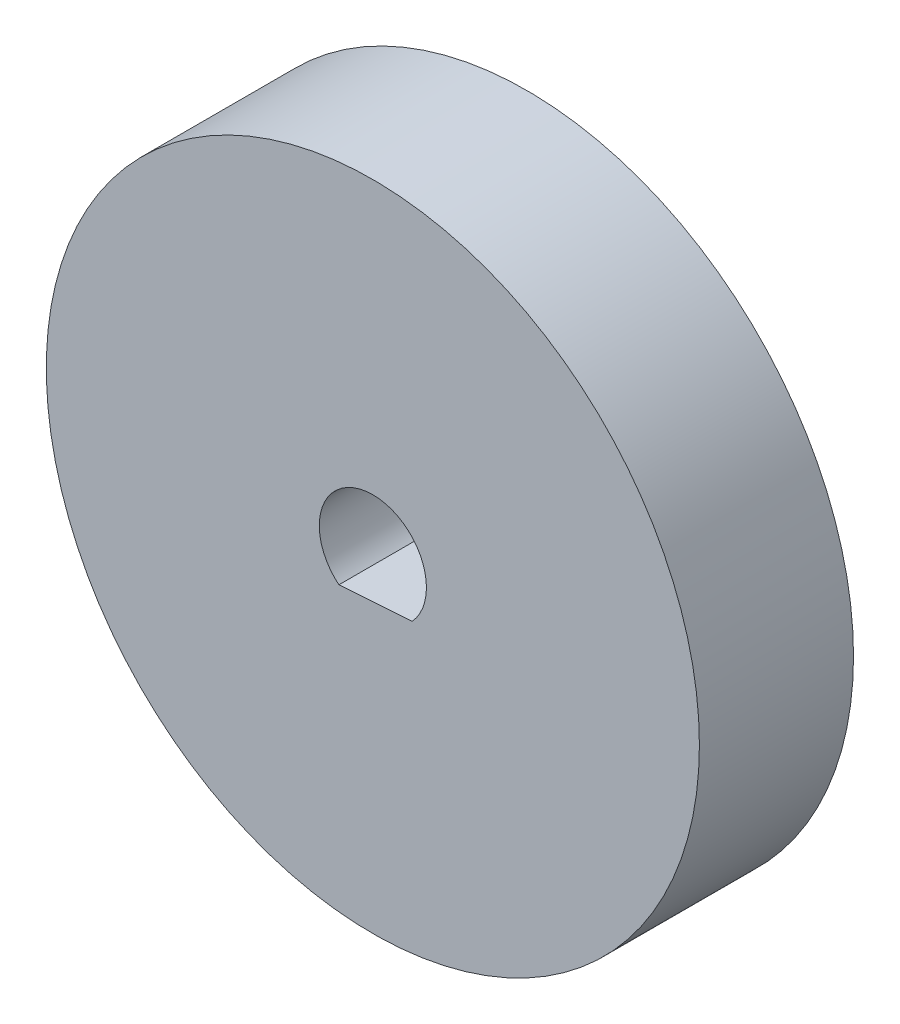
from build123d import *

# Parameters (mm, degrees)
SKETCH1_R           = 11.303
BOSS_EXTRUDE1_DEPTH = 5.334
CUT_EXTRUDE1_DEPTH  = 23.403000796


with BuildPart() as part:
    # Sketch1 → Boss-Extrude1 (new body)
    with BuildSketch(Plane.XY):
        with Locations((0, 7.2896082)):
            Circle(SKETCH1_R)
    extrude(amount=BOSS_EXTRUDE1_DEPTH)

    # Sketch2 → Cut-Extrude1 (cut, through all)
    with BuildSketch(Plane(origin=(0, 0, 0), x_dir=(-1, 0, 0), z_dir=(0, 0, -1))):
        with BuildLine():
            ThreePointArc((1.8542, 7.2896082), (-0.676172275, 9.01612165), (-1.361039666, 6.030390718))
            Line((-1.361039666, 6.030390718), (1.175011096, 5.855241941))
            ThreePointArc((1.175011096, 5.855241941), (1.675822666, 6.496086913), (1.8542, 7.2896082))
        make_face()
    extrude(amount=-CUT_EXTRUDE1_DEPTH, mode=Mode.SUBTRACT)


solid = part.part
